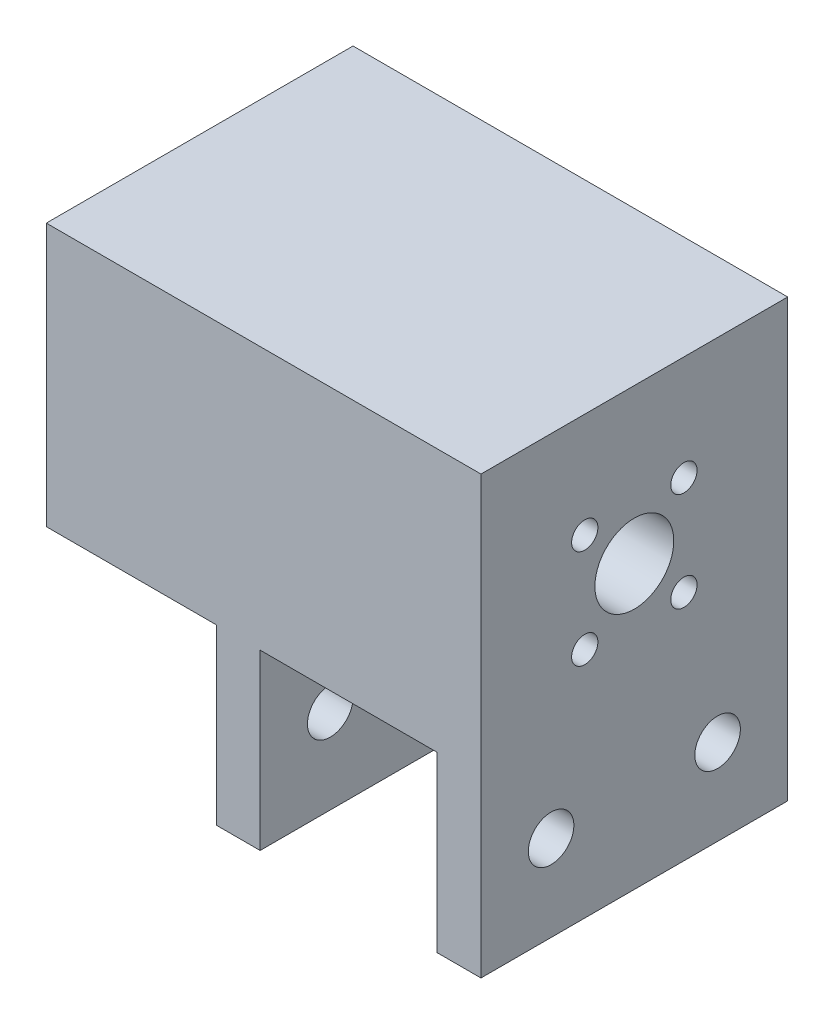
from build123d import *

# Parameters (mm, degrees)
EXTRUDE_1_DEPTH     = 35
HOLE_WIZARD_1_D     = 9
SKETCH_12_R         = 1.5
CUT_EXTRUDE_1_DEPTH = 70.548831766
SKETCH_15_R         = 5.2
CUT_EXTRUDE_4_DEPTH = 16
SKETCH_14_R         = 11.75
CUT_EXTRUDE_3_DEPTH = 4
HOLE_WIZARD_2_D     = 5.2
HOLE_WIZARD_2_DEPTH = 100
EXTRUDE_START       = 10
SKETCH_18_W         = 35
SKETCH_18_H         = 30
SKETCH_18_R         = 11.75
EXTRUDE_2_DEPTH     = 10
SKETCH_19_W         = 9.4
SKETCH_19_H         = 30
CUT_EXTRUDE_5_DEPTH = 61.218684808


with BuildPart() as part:
    # 草图1 → 凸台-拉伸1 (new body)
    with BuildSketch(Plane.XY):
        Polygon((10.1, -15), (10.1, -34.8), (15.1, -34.8), (15.1, -15), (24.5, -15), (24.5, 15), (-24.5, 15), (-24.5, -15), (-15.1, -15), (-15.1, -34.8), (-10.1, -34.8), (-10.1, -15), align=None)
    extrude(amount=EXTRUDE_1_DEPTH)

    # 孔1 (through all)
    with Locations(Plane.ZY.offset(24.5)):
        with Locations((17.5, -2.6)):
            Hole(HOLE_WIZARD_1_D / 2)

    # 草图12 → 切除-拉伸1 (cut, through all)
    with BuildSketch(Plane.ZY.offset(24.5)):
        with Locations((11.843145751, 3.056854249)):
            Circle(SKETCH_12_R)
        with Locations((23.156854249, 3.056854249)):
            Circle(SKETCH_12_R)
        with Locations((23.156854249, -8.256854249)):
            Circle(SKETCH_12_R)
        with Locations((11.843145751, -8.256854249)):
            Circle(SKETCH_12_R)
    extrude(amount=-CUT_EXTRUDE_1_DEPTH, mode=Mode.SUBTRACT)

    # 草图15 → 切除-拉伸4 (cut)
    with BuildSketch(Plane.ZY.offset(24.5)):
        with Locations((17.5, -2.6)):
            Circle(SKETCH_15_R)
    extrude(amount=-CUT_EXTRUDE_4_DEPTH, mode=Mode.SUBTRACT)

    # 草图14 → 切除-拉伸3 (cut)
    with BuildSketch(Plane.ZY.offset(24.5)):
        with Locations((17.5, -2.6)):
            Circle(SKETCH_14_R)
    extrude(amount=-CUT_EXTRUDE_3_DEPTH, mode=Mode.SUBTRACT)

    # 孔2
    with Locations(Plane.ZY.offset(15.1)):
        with Locations((8, -25), (27, -25)):
            Hole(HOLE_WIZARD_2_D / 2, depth=HOLE_WIZARD_2_DEPTH)

    # 草图18 → 凸台-拉伸2 (add)
    with BuildSketch(Plane.ZY.offset(24.5).offset(EXTRUDE_START)):
        with Locations((17.5, 0)):
            Rectangle(SKETCH_18_W, SKETCH_18_H)
        with Locations((17.5, -2.6)):
            Circle(SKETCH_18_R, mode=Mode.SUBTRACT)
    extrude(amount=-EXTRUDE_2_DEPTH)

    # 草图19 → 切除-拉伸5 (cut, through all)
    with BuildSketch(Plane(origin=(0, 0, 0), x_dir=(-1, 0, 0), z_dir=(0, 0, -1))):
        with Locations((-19.8, 0)):
            Rectangle(SKETCH_19_W, SKETCH_19_H)
    extrude(amount=-CUT_EXTRUDE_5_DEPTH, mode=Mode.SUBTRACT)


solid = part.part
